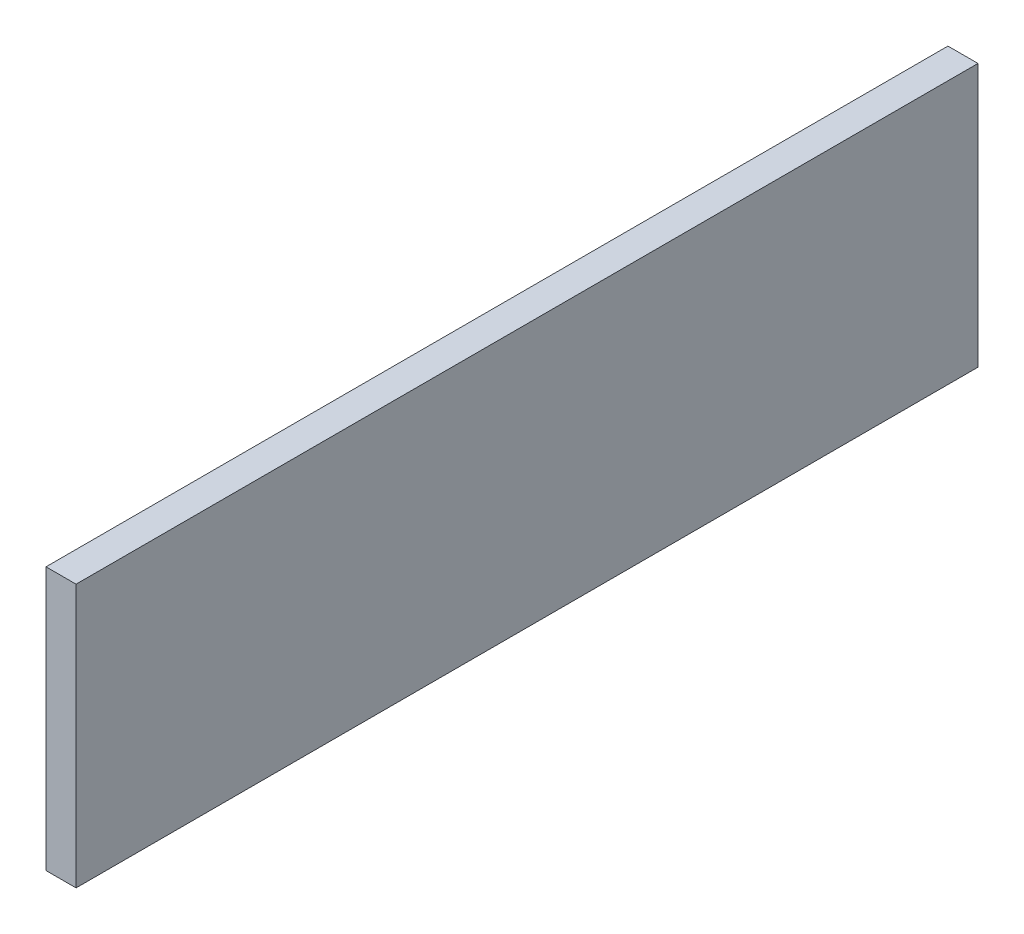
from build123d import *

# Parameters (mm, degrees)
SKETCH1_W           = 1200
SKETCH1_H           = 350
BOSS_EXTRUDE1_DEPTH = 40


with BuildPart() as part:
    # Sketch1 → Boss-Extrude1 (new body)
    with BuildSketch(Plane(origin=(0, 0, 0), x_dir=(0, 0, -1), z_dir=(1, 0, 0))):
        with Locations((48.148148148, 243.055555556)):
            Rectangle(SKETCH1_W, SKETCH1_H)
    extrude(amount=BOSS_EXTRUDE1_DEPTH)


solid = part.part
